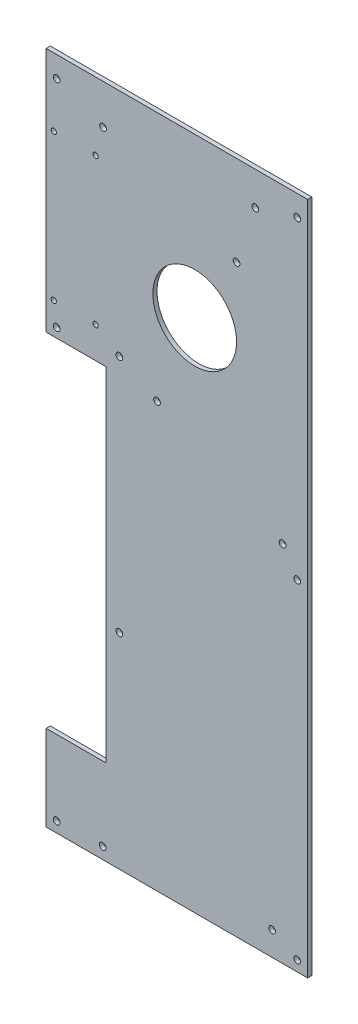
from build123d import *

# Parameters (mm, degrees)
SKETCH1_R           = 1.6
SKETCH1_R_2         = 20
SKETCH1_R_3         = 1.25
BOSS_EXTRUDE1_DEPTH = 2


with BuildPart() as part:
    # Sketch1 → Boss-Extrude1 (new body)
    with BuildSketch(Plane(origin=(0, 0, 0), x_dir=(0, 1, 0), z_dir=(0, 0, 1))):
        Polygon((-98, 35), (-98, -90), (224.3, -90), (224.3, 35), (106.85, 35), (106.85, 6.35), (-57.15, 6.35), (-57.15, 35), align=None)
        with Locations((-92.5, 8)):
            Circle(SKETCH1_R, mode=Mode.SUBTRACT)
        with Locations((-93, 30)):
            Circle(SKETCH1_R, mode=Mode.SUBTRACT)
        with Locations((205.3, 7.8)):
            Circle(SKETCH1_R, mode=Mode.SUBTRACT)
        with Locations((114.3, 0)):
            Circle(SKETCH1_R, mode=Mode.SUBTRACT)
        with Locations((-93, -85)):
            Circle(SKETCH1_R, mode=Mode.SUBTRACT)
        with Locations((-86.5, -73)):
            Circle(SKETCH1_R, mode=Mode.SUBTRACT)
        with Locations((64.3, -85)):
            Circle(SKETCH1_R, mode=Mode.SUBTRACT)
        with Locations((75.7, -78)):
            Circle(SKETCH1_R, mode=Mode.SUBTRACT)
        with Locations((214.3, -85)):
            Circle(SKETCH1_R, mode=Mode.SUBTRACT)
        with Locations((208.3, -65)):
            Circle(SKETCH1_R, mode=Mode.SUBTRACT)
        with Locations((181.3, -56)):
            Circle(SKETCH1_R, mode=Mode.SUBTRACT)
        with Locations((148.3, -36)):
            Circle(SKETCH1_R_2, mode=Mode.SUBTRACT)
        Circle(SKETCH1_R, mode=Mode.SUBTRACT)
        with Locations((104.8, -18)):
            Circle(SKETCH1_R, mode=Mode.SUBTRACT)
        with Locations((191.85, 31.35)):
            Circle(SKETCH1_R_3, mode=Mode.SUBTRACT)
        with Locations((121.85, 11.35)):
            Circle(SKETCH1_R_3, mode=Mode.SUBTRACT)
        with Locations((111.3, 30)):
            Circle(SKETCH1_R, mode=Mode.SUBTRACT)
        with Locations((121.85, 31.35)):
            Circle(SKETCH1_R_3, mode=Mode.SUBTRACT)
        with Locations((191.85, 11.35)):
            Circle(SKETCH1_R_3, mode=Mode.SUBTRACT)
        with Locations((214.3, 30)):
            Circle(SKETCH1_R, mode=Mode.SUBTRACT)
    extrude(amount=-BOSS_EXTRUDE1_DEPTH)


solid = part.part
